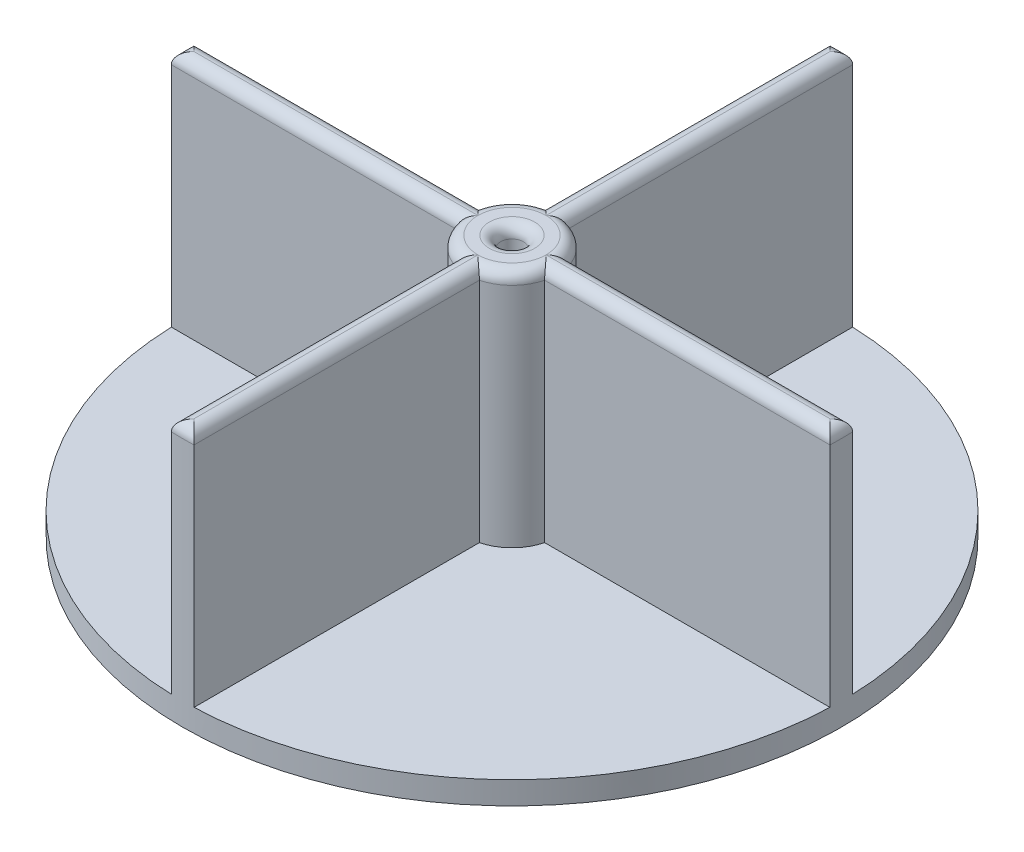
from build123d import *

# Parameters (mm, degrees)
SKETCH1_R           = 23.2
BOSS_EXTRUDE1_DEPTH = 1.6
BOSS_EXTRUDE2_DEPTH = 16.8
SKETCH3_R           = 0.7999999999999999
CUT_EXTRUDE1_DEPTH  = 38.617017425628
FILLET2_R           = 0.8


with BuildPart() as part:
    # Sketch1 → Boss-Extrude1 (new body)
    with BuildSketch(Plane(origin=(0, 0, 0), x_dir=(1, 0, 0), z_dir=(0, 1, 0))):
        with Locations(Location((0, 0, 0), (0, 0, 270))):
            Circle(SKETCH1_R)
    extrude(amount=BOSS_EXTRUDE1_DEPTH)

    # Sketch2 → Boss-Extrude2 (add)
    with BuildSketch(Plane(origin=(0, 1.6, 0), x_dir=(1, 0, 0), z_dir=(0, 1, 0))):
        with BuildLine():
            ThreePointArc((-0.7999999999999885, 3.098386676965936), (-2.2627416997969467, 2.2627416997969556), (-3.0983866769659336, 0.8000000000000005))
            Line((-3.098386676965933, 0.8000000000000005), (-23.1862027939031, 0.7999999999999974))
            ThreePointArc((-23.1862027939031, 0.7999999999999975), (-23.2, -3e-17), (-23.1862027939031, -0.7999999999999976))
            Line((-23.1862027939031, -0.7999999999999974), (-3.098386676965933, -0.7999999999999997))
            ThreePointArc((-3.0983866769659327, -0.7999999999999998), (-2.262741699796952, -2.262741699796952), (-0.7999999999999998, -3.0983866769659336))
            Line((-0.7999999999999999, -3.0983866769659336), (-0.8000000000002397, -23.186202793903092))
            ThreePointArc((-0.8000000000002399, -23.186202793903092), (-2.4261e-13, -23.200000000000003), (0.799999999999755, -23.186202793903107))
            Line((0.7999999999997549, -23.186202793903107), (0.7999999999999677, -3.0983866769659416))
            ThreePointArc((0.7999999999999678, -3.098386676965942), (2.2627416997969316, -2.2627416997969716), (3.0983866769659274, -0.8000000000000215))
            Line((3.098386676965927, -0.8000000000000214), (23.186202793903092, -0.8000000000001593))
            ThreePointArc((23.186202793903096, -0.8000000000001596), (23.199999999999996, -1.6184e-13), (23.18620279390311, 0.799999999999836))
            Line((23.186202793903107, 0.7999999999998355), (3.098386676965938, 0.7999999999999781))
            ThreePointArc((3.098386676965938, 0.7999999999999781), (2.262741699796959, 2.262741699796943), (0.8000000000000003, 3.0983866769659336))
            Line((0.8000000000000003, 3.098386676965933), (0.8000000000000788, 23.186202793903096))
            ThreePointArc((0.8000000000000786, 23.186202793903096), (8.138e-14, 23.199999999999992), (-0.799999999999916, 23.1862027939031))
            Line((-0.7999999999999159, 23.186202793903107), (-0.7999999999999884, 3.0983866769659354))
        make_face()
    extrude(amount=BOSS_EXTRUDE2_DEPTH)

    # Sketch3 → Cut-Extrude1 (cut, through all)
    with BuildSketch(Plane(origin=(0, 0, 0), x_dir=(-1, 0, 0), z_dir=(0, -1, 0))):
        with Locations(Location((0, 0, 0), (0, 0, 90))):
            Circle(SKETCH3_R)
    extrude(amount=-CUT_EXTRUDE1_DEPTH, mode=Mode.SUBTRACT)

    # Fillet2
    # the kernel refuses this fillet: 0.8 mm, written as the material it takes off along each edge
    with BuildSketch(Plane(origin=(-25.1862027939031, 18.400000000000002, 0.7999999999999972), x_dir=(1.2e-16, 0, -1), z_dir=(1, 0, 1.2e-16))) as fillet2_piece_1_section:
        with BuildLine():
            CenterArc((FILLET2_R, -FILLET2_R), FILLET2_R, 90, 90)
            Line((-1.1e-16, -FILLET2_R), (0, 0))
            Line((0, 0), (FILLET2_R, 0))
        make_face()
    fillet2_piece_1 = extrude(amount=24.08781611693717, mode=Mode.PRIVATE)
    fillet2_piece_1 = fillet2_piece_1 - Plane(origin=(-1.67e-15, 18.21874056473575, 2.89e-15), x_dir=(-0.9682458365518545, 0, 0.2499999999999993), z_dir=(0, -1, 0)) * Cylinder(3.199999999999997, 52, mode=Mode.PRIVATE)
    add(fillet2_piece_1, mode=Mode.SUBTRACT)
    with BuildSketch(Plane(origin=(0.7999999999997337, 18.400000000000002, 25.186202793903107), x_dir=(-1, 0, -1.059e-14), z_dir=(1.059e-14, 0, -1))) as fillet2_piece_2_section:
        with BuildLine():
            CenterArc((FILLET2_R, -FILLET2_R), FILLET2_R, 90, 90)
            Line((-1.1e-16, -FILLET2_R), (0, 0))
            Line((0, 0), (FILLET2_R, 0))
        make_face()
    fillet2_piece_2 = extrude(amount=24.08781611693717, mode=Mode.PRIVATE)
    fillet2_piece_2 = fillet2_piece_2 - Plane(origin=(-3.11e-15, 18.218740564735754, -2.22e-15), x_dir=(0.2499999999999907, 0, 0.9682458365518567), z_dir=(0, -1, 0)) * Cylinder(3.2000000000000033, 52, mode=Mode.PRIVATE)
    add(fillet2_piece_2, mode=Mode.SUBTRACT)
    with BuildSketch(Plane(origin=(25.186202793903107, 18.400000000000002, -0.7999999999998213), x_dir=(-7.1e-15, 0, 1), z_dir=(-1, 0, -7.1e-15))) as fillet2_piece_3_section:
        with BuildLine():
            CenterArc((FILLET2_R, -FILLET2_R), FILLET2_R, 90, 90)
            Line((-1.1e-16, -FILLET2_R), (0, 0))
            Line((0, 0), (FILLET2_R, 0))
        make_face()
    fillet2_piece_3 = extrude(amount=24.087816116937173, mode=Mode.PRIVATE)
    fillet2_piece_3 = fillet2_piece_3 - Plane(origin=(-4.66e-15, 18.21874056473575, 2.89e-15), x_dir=(0.9682458365518558, 0, -0.24999999999999373), z_dir=(0, -1, 0)) * Cylinder(3.200000000000004, 52, mode=Mode.PRIVATE)
    add(fillet2_piece_3, mode=Mode.SUBTRACT)
    with BuildSketch(Plane(origin=(-0.7999999999999087, 18.400000000000002, -25.186202793903107), x_dir=(1, 0, 3.61e-15), z_dir=(-3.61e-15, 0, 1))) as fillet2_piece_4_section:
        with BuildLine():
            CenterArc((FILLET2_R, -FILLET2_R), FILLET2_R, 90, 90)
            Line((-1.1e-16, -FILLET2_R), (0, 0))
            Line((0, 0), (FILLET2_R, 0))
        make_face()
    fillet2_piece_4 = extrude(amount=24.087816116937173, mode=Mode.PRIVATE)
    fillet2_piece_4 = fillet2_piece_4 - Plane(origin=(7.77e-15, 18.21874056473575, 8.88e-15), x_dir=(-0.24999999999999808, 0, -0.9682458365518548), z_dir=(0, -1, 0)) * Cylinder(3.20000000000001, 52, mode=Mode.PRIVATE)
    add(fillet2_piece_4, mode=Mode.SUBTRACT)
    with BuildSketch(Plane(origin=(1.81188e-12, 18.400000000000002, 3e-17), x_dir=(-0.9927250083594872, 0, -0.12040372825480125), z_dir=(0.12040372825480125, 0, -0.9927250083594872))) as fillet2_piece_5:
        with BuildLine():
            CenterArc((23.2000000000018 - FILLET2_R, -FILLET2_R), FILLET2_R, 0, 90)
            Line((23.200000000001797, -FILLET2_R), (23.2000000000018, 0))
            Line((23.2000000000018, 0), (23.2000000000018 - FILLET2_R, 0))
        make_face()
    revolve(axis=Axis((1.81188e-12, 18.400000000000002, 3e-17), (0, 1, 0)), revolution_arc=13.83080689642434, mode=Mode.SUBTRACT)
    with BuildSketch(Plane(origin=(-1.67e-15, 18.400000000000002, 2.89e-15), x_dir=(-0.9314439639162286, 0, -0.36388479232309684), z_dir=(0.36388479232309684, 0, -0.9314439639162286))) as fillet2_piece_6_section:
        with BuildLine():
            CenterArc((3.200000000000247 - FILLET2_R, -FILLET2_R), FILLET2_R, 0, 90)
            Line((3.200000000000247, -FILLET2_R), (3.200000000000247, 0))
            Line((3.200000000000247, 0), (3.200000000000247 - FILLET2_R, 0))
        make_face()
    fillet2_piece_6 = revolve(axis=Axis((-1.67e-15, 18.400000000000002, 2.89e-15), (0, 1, 0)), revolution_arc=132.67793405188988, mode=Mode.PRIVATE)
    fillet2_piece_6 = split(fillet2_piece_6, bisect_by=Plane(origin=(-2.899483570840335, 18.197678249035157, -0.8000000000000005), z_dir=(-1.5e-16, 0, -1)), keep=Keep.TOP, mode=Mode.PRIVATE)
    add(fillet2_piece_6, mode=Mode.SUBTRACT)
    with BuildSketch(Plane(origin=(-1.67e-15, 18.400000000000002, 2.89e-15), x_dir=(-0.9314439639162286, 0, -0.36388479232309684), z_dir=(0.36388479232309684, 0, -0.9314439639162286))) as fillet2_piece_7_section:
        with BuildLine():
            CenterArc((3.200000000000247 - FILLET2_R, -FILLET2_R), FILLET2_R, 0, 90)
            Line((3.200000000000247, -FILLET2_R), (3.200000000000247, 0))
            Line((3.200000000000247, 0), (3.200000000000247 - FILLET2_R, 0))
        make_face()
    fillet2_piece_7 = revolve(axis=Axis((-1.67e-15, 18.400000000000002, 2.89e-15), (0, 1, 0)), revolution_arc=132.67793405188988, mode=Mode.PRIVATE)
    fillet2_piece_7 = split(fillet2_piece_7, bisect_by=Plane(origin=(-0.799999999999988, 18.171333398613715, 2.101049995326022), z_dir=(-1, 0, -1.194e-14)), keep=Keep.TOP, mode=Mode.PRIVATE)
    fillet2_piece_7 = split(fillet2_piece_7, bisect_by=Plane(origin=(-2.101049995326008, 18.171333398613715, 0.7999999999999998), z_dir=(-1.2e-16, 0, 1)), keep=Keep.TOP, mode=Mode.PRIVATE)
    add(fillet2_piece_7, mode=Mode.SUBTRACT)
    with BuildSketch(Plane(origin=(-1.67e-15, 18.400000000000002, 2.89e-15), x_dir=(-0.9314439639162286, 0, -0.36388479232309684), z_dir=(0.36388479232309684, 0, -0.9314439639162286))) as fillet2_piece_8_section:
        with BuildLine():
            CenterArc((3.200000000000247 - FILLET2_R, -FILLET2_R), FILLET2_R, 0, 90)
            Line((3.200000000000247, -FILLET2_R), (3.200000000000247, 0))
            Line((3.200000000000247, 0), (3.200000000000247 - FILLET2_R, 0))
        make_face()
    fillet2_piece_8 = revolve(axis=Axis((-1.67e-15, 18.400000000000002, 2.89e-15), (0, 1, 0)), revolution_arc=132.67793405188988, mode=Mode.PRIVATE)
    fillet2_piece_8 = split(fillet2_piece_8, bisect_by=Plane(origin=(0.7999999999999698, 18.197678297471455, 2.899483575164183), z_dir=(1, 0, 1.059e-14)), keep=Keep.TOP, mode=Mode.PRIVATE)
    add(fillet2_piece_8, mode=Mode.SUBTRACT)
    with BuildSketch(Plane(origin=(-0.7999999999999761, 18.400000000000002, 1.0983866769659318), x_dir=(0, -1, 0), z_dir=(-1.194e-14, 0, 1))) as fillet2_piece_9_section:
        with BuildLine():
            CenterArc((FILLET2_R, FILLET2_R), FILLET2_R, 180, 90)
            Line((0, FILLET2_R), (0, 0))
            Line((0, 0), (FILLET2_R, 0))
        make_face()
    fillet2_piece_9 = extrude(amount=24.087816116937162, mode=Mode.PRIVATE)
    fillet2_piece_9 = fillet2_piece_9 - Plane(origin=(-1.67e-15, 18.218740589292803, 2.89e-15), x_dir=(-0.9682458365518545, 0, 0.2499999999999993), z_dir=(0, -1, 0)) * Cylinder(3.199999999999997, 52, mode=Mode.PRIVATE)
    add(fillet2_piece_9, mode=Mode.SUBTRACT)
    with BuildSketch(Plane(origin=(-3.653e-14, 18.400000000000002, 5.22427e-12), x_dir=(-0.12040372825484637, 0, 0.9927250083594816), z_dir=(-0.9927250083594816, 0, -0.12040372825484637))) as fillet2_piece_10:
        with BuildLine():
            CenterArc((23.199999999994805 - FILLET2_R, -FILLET2_R), FILLET2_R, 0, 90)
            Line((23.199999999994805 - FILLET2_R, 0), (23.199999999994805, 0))
            Line((23.199999999994805, 0), (23.199999999994805, -FILLET2_R))
        make_face()
    revolve(axis=Axis((-3.653e-14, 18.400000000000002, 5.22427e-12), (0, 1, 0)), revolution_arc=13.830806896428529, mode=Mode.SUBTRACT)
    with BuildSketch(Plane(origin=(-3.11e-15, 18.400000000000002, -2.22e-15), x_dir=(-0.3638847923231041, 0, 0.9314439639162259), z_dir=(-0.9314439639162259, 0, -0.3638847923231041))) as fillet2_piece_11_section:
        with BuildLine():
            CenterArc((3.2000000000002538 - FILLET2_R, -FILLET2_R), FILLET2_R, 0, 90)
            Line((3.2000000000002538, -FILLET2_R), (3.2000000000002538, 0))
            Line((3.2000000000002538, 0), (3.2000000000002538 - FILLET2_R, 0))
        make_face()
    fillet2_piece_11 = revolve(axis=Axis((-3.11e-15, 18.400000000000002, -2.22e-15), (0, 1, 0)), revolution_arc=132.6779340518898, mode=Mode.PRIVATE)
    fillet2_piece_11 = split(fillet2_piece_11, bisect_by=Plane(origin=(-0.7999999999999976, 18.19767824903516, 2.8994835708403333), z_dir=(-1, 0, -1.194e-14)), keep=Keep.TOP, mode=Mode.PRIVATE)
    add(fillet2_piece_11, mode=Mode.SUBTRACT)
    with BuildSketch(Plane(origin=(-3.11e-15, 18.400000000000002, -2.22e-15), x_dir=(-0.3638847923231041, 0, 0.9314439639162259), z_dir=(-0.9314439639162259, 0, -0.3638847923231041))) as fillet2_piece_12_section:
        with BuildLine():
            CenterArc((3.2000000000002538 - FILLET2_R, -FILLET2_R), FILLET2_R, 0, 90)
            Line((3.2000000000002538, -FILLET2_R), (3.2000000000002538, 0))
            Line((3.2000000000002538, 0), (3.2000000000002538 - FILLET2_R, 0))
        make_face()
    fillet2_piece_12 = revolve(axis=Axis((-3.11e-15, 18.400000000000002, -2.22e-15), (0, 1, 0)), revolution_arc=132.6779340518898, mode=Mode.PRIVATE)
    fillet2_piece_12 = split(fillet2_piece_12, bisect_by=Plane(origin=(0.7999999999999783, 18.171333398613715, 2.1010499953260116), z_dir=(1, 0, 1.059e-14)), keep=Keep.TOP, mode=Mode.PRIVATE)
    fillet2_piece_12 = split(fillet2_piece_12, bisect_by=Plane(origin=(2.1010499953259982, 18.171333398613715, 0.8000000000000145), z_dir=(-6.86e-15, 0, 1)), keep=Keep.TOP, mode=Mode.PRIVATE)
    add(fillet2_piece_12, mode=Mode.SUBTRACT)
    with BuildSketch(Plane(origin=(-3.11e-15, 18.400000000000002, -2.22e-15), x_dir=(-0.3638847923231041, 0, 0.9314439639162259), z_dir=(-0.9314439639162259, 0, -0.3638847923231041))) as fillet2_piece_13_section:
        with BuildLine():
            CenterArc((3.2000000000002538 - FILLET2_R, -FILLET2_R), FILLET2_R, 0, 90)
            Line((3.2000000000002538, -FILLET2_R), (3.2000000000002538, 0))
            Line((3.2000000000002538, 0), (3.2000000000002538 - FILLET2_R, 0))
        make_face()
    fillet2_piece_13 = revolve(axis=Axis((-3.11e-15, 18.400000000000002, -2.22e-15), (0, 1, 0)), revolution_arc=132.6779340518898, mode=Mode.PRIVATE)
    fillet2_piece_13 = split(fillet2_piece_13, bisect_by=Plane(origin=(2.8994835751641936, 18.197678297471455, -0.7999999999999795), z_dir=(7.1e-15, 0, -1)), keep=Keep.TOP, mode=Mode.PRIVATE)
    add(fillet2_piece_13, mode=Mode.SUBTRACT)
    with BuildSketch(Plane(origin=(1.0983866769659252, 18.400000000000002, 0.8000000000000076), x_dir=(6.86e-15, 0, -1), z_dir=(1, 0, 6.86e-15))) as fillet2_piece_14_section:
        with BuildLine():
            CenterArc((FILLET2_R, -FILLET2_R), FILLET2_R, 90, 90)
            Line((-1.1e-16, -FILLET2_R), (0, 0))
            Line((0, 0), (FILLET2_R, 0))
        make_face()
    fillet2_piece_14 = extrude(amount=24.08781611693717, mode=Mode.PRIVATE)
    fillet2_piece_14 = fillet2_piece_14 - Plane(origin=(-3.11e-15, 18.21874057940672, -2.22e-15), x_dir=(0.2499999999999907, 0, 0.9682458365518567), z_dir=(0, -1, 0)) * Cylinder(3.2000000000000033, 52, mode=Mode.PRIVATE)
    add(fillet2_piece_14, mode=Mode.SUBTRACT)
    with BuildSketch(Plane(origin=(-7.19247e-12, 18.400000000000002, -4.416e-14), x_dir=(0.9927250083594895, 0, 0.12040372825478234), z_dir=(-0.12040372825478234, 0, 0.9927250083594895))) as fillet2_piece_15:
        with BuildLine():
            CenterArc((23.200000000007144 - FILLET2_R, -FILLET2_R), FILLET2_R, 0, 90)
            Line((23.200000000007144 - FILLET2_R, 0), (23.200000000007144, 0))
            Line((23.200000000007144, 0), (23.200000000007144, -FILLET2_R))
        make_face()
    revolve(axis=Axis((-7.19247e-12, 18.400000000000002, -4.416e-14), (0, 1, 0)), revolution_arc=13.830806896421134, mode=Mode.SUBTRACT)
    with BuildSketch(Plane(origin=(-4.66e-15, 18.400000000000002, 2.89e-15), x_dir=(0.931443963916227, 0, 0.36388479232310106), z_dir=(-0.36388479232310106, 0, 0.931443963916227))) as fillet2_piece_16_section:
        with BuildLine():
            CenterArc((3.2000000000002524 - FILLET2_R, -FILLET2_R), FILLET2_R, 0, 90)
            Line((3.200000000000252, -FILLET2_R), (3.2000000000002524, 0))
            Line((3.2000000000002524, 0), (3.2000000000002524 - FILLET2_R, 0))
        make_face()
    fillet2_piece_16 = revolve(axis=Axis((-4.66e-15, 18.400000000000002, 2.89e-15), (0, 1, 0)), revolution_arc=132.67793405189, mode=Mode.PRIVATE)
    fillet2_piece_16 = split(fillet2_piece_16, bisect_by=Plane(origin=(2.8994835708403315, 18.197678249035157, 0.80000000000002), z_dir=(-6.86e-15, 0, 1)), keep=Keep.TOP, mode=Mode.PRIVATE)
    add(fillet2_piece_16, mode=Mode.SUBTRACT)
    with BuildSketch(Plane(origin=(-4.66e-15, 18.400000000000002, 2.89e-15), x_dir=(0.931443963916227, 0, 0.36388479232310106), z_dir=(-0.36388479232310106, 0, 0.931443963916227))) as fillet2_piece_17_section:
        with BuildLine():
            CenterArc((3.2000000000002524 - FILLET2_R, -FILLET2_R), FILLET2_R, 0, 90)
            Line((3.200000000000252, -FILLET2_R), (3.2000000000002524, 0))
            Line((3.2000000000002524, 0), (3.2000000000002524 - FILLET2_R, 0))
        make_face()
    fillet2_piece_17 = revolve(axis=Axis((-4.66e-15, 18.400000000000002, 2.89e-15), (0, 1, 0)), revolution_arc=132.67793405189, mode=Mode.PRIVATE)
    fillet2_piece_17 = split(fillet2_piece_17, bisect_by=Plane(origin=(2.1010499953260044, 18.171333398613715, -0.7999999999999852), z_dir=(7.1e-15, 0, -1)), keep=Keep.TOP, mode=Mode.PRIVATE)
    fillet2_piece_17 = split(fillet2_piece_17, bisect_by=Plane(origin=(0.7999999999999964, 18.171333398613715, -2.1010499953260013), z_dir=(1, 0, 3.91e-15)), keep=Keep.TOP, mode=Mode.PRIVATE)
    add(fillet2_piece_17, mode=Mode.SUBTRACT)
    with BuildSketch(Plane(origin=(-4.66e-15, 18.400000000000002, 2.89e-15), x_dir=(0.931443963916227, 0, 0.36388479232310106), z_dir=(-0.36388479232310106, 0, 0.931443963916227))) as fillet2_piece_18_section:
        with BuildLine():
            CenterArc((3.2000000000002524 - FILLET2_R, -FILLET2_R), FILLET2_R, 0, 90)
            Line((3.200000000000252, -FILLET2_R), (3.2000000000002524, 0))
            Line((3.2000000000002524, 0), (3.2000000000002524 - FILLET2_R, 0))
        make_face()
    fillet2_piece_18 = revolve(axis=Axis((-4.66e-15, 18.400000000000002, 2.89e-15), (0, 1, 0)), revolution_arc=132.67793405189, mode=Mode.PRIVATE)
    fillet2_piece_18 = split(fillet2_piece_18, bisect_by=Plane(origin=(-0.799999999999989, 18.19767829747145, -2.8994835751641865), z_dir=(-1, 0, -3.61e-15)), keep=Keep.TOP, mode=Mode.PRIVATE)
    add(fillet2_piece_18, mode=Mode.SUBTRACT)
    with BuildSketch(Plane(origin=(0.7999999999999925, 18.400000000000002, -1.0983866769659314), x_dir=(-1, 0, -3.91e-15), z_dir=(3.91e-15, 0, -1))) as fillet2_piece_19_section:
        with BuildLine():
            CenterArc((FILLET2_R, -FILLET2_R), FILLET2_R, 90, 90)
            Line((-1.1e-16, -FILLET2_R), (0, 0))
            Line((0, 0), (FILLET2_R, 0))
        make_face()
    fillet2_piece_19 = extrude(amount=24.08781611693717, mode=Mode.PRIVATE)
    fillet2_piece_19 = fillet2_piece_19 - Plane(origin=(-4.66e-15, 18.21874057940672, 2.89e-15), x_dir=(0.9682458365518558, 0, -0.24999999999999373), z_dir=(0, -1, 0)) * Cylinder(3.200000000000004, 52, mode=Mode.PRIVATE)
    add(fillet2_piece_19, mode=Mode.SUBTRACT)
    with BuildSketch(Plane(origin=(2.984e-14, 18.400000000000002, 5.85487e-12), x_dir=(0.12040372825478259, 0, -0.9927250083594896), z_dir=(0.9927250083594896, 0, 0.12040372825478259))) as fillet2_piece_20:
        with BuildLine():
            CenterArc((23.20000000000581 - FILLET2_R, -FILLET2_R), FILLET2_R, 0, 90)
            Line((23.20000000000581 - FILLET2_R, 0), (23.20000000000581, 0))
            Line((23.20000000000581, 0), (23.20000000000581, -FILLET2_R))
        make_face()
    revolve(axis=Axis((2.984e-14, 18.400000000000002, 5.85487e-12), (0, 1, 0)), revolution_arc=13.83080689642193, mode=Mode.SUBTRACT)
    with BuildSketch(Plane(origin=(7.77e-15, 18.400000000000002, 8.88e-15), x_dir=(0.36388479232309584, 0, -0.9314439639162291), z_dir=(0.9314439639162291, 0, 0.36388479232309584))) as fillet2_piece_21_section:
        with BuildLine():
            CenterArc((3.200000000000259 - FILLET2_R, -FILLET2_R), FILLET2_R, 0, 90)
            Line((3.200000000000259, -FILLET2_R), (3.200000000000259, 0))
            Line((3.200000000000259, 0), (3.200000000000259 - FILLET2_R, 0))
        make_face()
    fillet2_piece_21 = revolve(axis=Axis((7.77e-15, 18.400000000000002, 8.88e-15), (0, 1, 0)), revolution_arc=132.6779340518895, mode=Mode.PRIVATE)
    fillet2_piece_21 = split(fillet2_piece_21, bisect_by=Plane(origin=(0.7999999999999995, 18.197678249035153, -2.899483570840339), z_dir=(1, 0, 3.91e-15)), keep=Keep.TOP, mode=Mode.PRIVATE)
    add(fillet2_piece_21, mode=Mode.SUBTRACT)
    with BuildSketch(Plane(origin=(7.77e-15, 18.400000000000002, 8.88e-15), x_dir=(0.36388479232309584, 0, -0.9314439639162291), z_dir=(0.9314439639162291, 0, 0.36388479232309584))) as fillet2_piece_22_section:
        with BuildLine():
            CenterArc((3.200000000000259 - FILLET2_R, -FILLET2_R), FILLET2_R, 0, 90)
            Line((3.200000000000259, -FILLET2_R), (3.200000000000259, 0))
            Line((3.200000000000259, 0), (3.200000000000259 - FILLET2_R, 0))
        make_face()
    fillet2_piece_22 = revolve(axis=Axis((7.77e-15, 18.400000000000002, 8.88e-15), (0, 1, 0)), revolution_arc=132.6779340518895, mode=Mode.PRIVATE)
    fillet2_piece_22 = split(fillet2_piece_22, bisect_by=Plane(origin=(-0.7999999999999919, 18.171333398613715, -2.1010499953260044), z_dir=(-1, 0, -3.61e-15)), keep=Keep.TOP, mode=Mode.PRIVATE)
    fillet2_piece_22 = split(fillet2_piece_22, bisect_by=Plane(origin=(-2.1010499953260005, 18.171333398613715, -0.8000000000000006), z_dir=(-1.5e-16, 0, -1)), keep=Keep.TOP, mode=Mode.PRIVATE)
    add(fillet2_piece_22, mode=Mode.SUBTRACT)
    with BuildSketch(Plane(origin=(7.77e-15, 18.400000000000002, 8.88e-15), x_dir=(0.36388479232309584, 0, -0.9314439639162291), z_dir=(0.9314439639162291, 0, 0.36388479232309584))) as fillet2_piece_23_section:
        with BuildLine():
            CenterArc((3.200000000000259 - FILLET2_R, -FILLET2_R), FILLET2_R, 0, 90)
            Line((3.200000000000259, -FILLET2_R), (3.200000000000259, 0))
            Line((3.200000000000259, 0), (3.200000000000259 - FILLET2_R, 0))
        make_face()
    fillet2_piece_23 = revolve(axis=Axis((7.77e-15, 18.400000000000002, 8.88e-15), (0, 1, 0)), revolution_arc=132.6779340518895, mode=Mode.PRIVATE)
    fillet2_piece_23 = split(fillet2_piece_23, bisect_by=Plane(origin=(-2.8994835751641936, 18.19767829747145, 0.7999999999999997), z_dir=(-1.2e-16, 0, 1)), keep=Keep.TOP, mode=Mode.PRIVATE)
    add(fillet2_piece_23, mode=Mode.SUBTRACT)
    with BuildSketch(Plane(origin=(-1.0983866769659314, 18.400000000000002, -0.8000000000000008), x_dir=(1.5e-16, 0, 1), z_dir=(-1, 0, 1.5e-16))) as fillet2_piece_24_section:
        with BuildLine():
            CenterArc((FILLET2_R, -FILLET2_R), FILLET2_R, 90, 90)
            Line((-1.1e-16, -FILLET2_R), (0, 0))
            Line((0, 0), (FILLET2_R, 0))
        make_face()
    fillet2_piece_24 = extrude(amount=24.087816116937173, mode=Mode.PRIVATE)
    fillet2_piece_24 = fillet2_piece_24 - Plane(origin=(7.77e-15, 18.218740579406724, 8.88e-15), x_dir=(-0.24999999999999808, 0, -0.9682458365518548), z_dir=(0, -1, 0)) * Cylinder(3.20000000000001, 52, mode=Mode.PRIVATE)
    add(fillet2_piece_24, mode=Mode.SUBTRACT)
    with BuildSketch(Plane(origin=(0, 18.400000000000002, 0), x_dir=(-6e-17, 0, -1), z_dir=(-1, 0, 6e-17))) as fillet2_piece_25:
        with BuildLine():
            CenterArc((0.7999999999999999 + FILLET2_R, FILLET2_R), FILLET2_R, 180, 90)
            Line((0.7999999999999998, FILLET2_R), (0.7999999999999999, 0))
            Line((0.7999999999999999, 0), (0.7999999999999999 + FILLET2_R, 0))
        make_face()
    revolve(axis=Axis((0, 18.400000000000002, 0), (0, -1, 0)), mode=Mode.SUBTRACT)
    with BuildSketch(Plane(origin=(-1.67e-15, 18.400000000000002, 2.89e-15), x_dir=(-0.9314439639162286, 0, -0.36388479232309684), z_dir=(0.36388479232309684, 0, -0.9314439639162286))) as fillet2_piece_26a_section:
        with BuildLine():
            CenterArc((3.200000000000247 - FILLET2_R, -FILLET2_R), FILLET2_R, 0, 90)
            Line((3.200000000000247, -FILLET2_R), (3.200000000000247, 0))
            Line((3.200000000000247, 0), (3.200000000000247 - FILLET2_R, 0))
        make_face()
    fillet2_piece_26a = revolve(axis=Axis((-1.67e-15, 18.400000000000002, 2.89e-15), (0, 1, 0)), revolution_arc=132.67793405188988, mode=Mode.PRIVATE)
    fillet2_piece_26a = split(fillet2_piece_26a, bisect_by=Plane(origin=(-2.9823993189922824, 18.21903926693095, 0.7999999999999997), z_dir=(1.2e-16, 0, -1)), keep=Keep.TOP, mode=Mode.PRIVATE)
    fillet2_piece_26a = split(fillet2_piece_26a, bisect_by=Plane(origin=(-2.982399318992282, 18.21903926693095, -0.8000000000000005), z_dir=(1.5e-16, 0, 1)), keep=Keep.TOP, mode=Mode.PRIVATE)
    with BuildSketch(Plane(origin=(-25.1862027939031, 18.400000000000002, 0.7999999999999972), x_dir=(1.2e-16, 0, -1), z_dir=(1, 0, 1.2e-16))) as fillet2_piece_26b_section:
        with BuildLine():
            CenterArc((FILLET2_R, -FILLET2_R), FILLET2_R, 90, 90)
            Line((-1.1e-16, -FILLET2_R), (0, 0))
            Line((0, 0), (FILLET2_R, 0))
        make_face()
    fillet2_piece_26b = extrude(amount=24.08781611693717, mode=Mode.PRIVATE)
    fillet2_piece_26b = fillet2_piece_26b & Plane(origin=(-1.67e-15, 18.220436085358216, 2.89e-15), x_dir=(-0.9682458365518545, 0, 0.2499999999999993), z_dir=(0, -1, 0)) * Cylinder(3.199999999999997, 52, mode=Mode.PRIVATE)
    fillet2_piece_26 = fillet2_piece_26a & fillet2_piece_26b
    add(fillet2_piece_26, mode=Mode.SUBTRACT)
    with BuildSketch(Plane(origin=(-3.11e-15, 18.400000000000002, -2.22e-15), x_dir=(-0.3638847923231041, 0, 0.9314439639162259), z_dir=(-0.9314439639162259, 0, -0.3638847923231041))) as fillet2_piece_27a_section:
        with BuildLine():
            CenterArc((3.2000000000002538 - FILLET2_R, -FILLET2_R), FILLET2_R, 0, 90)
            Line((3.2000000000002538, -FILLET2_R), (3.2000000000002538, 0))
            Line((3.2000000000002538, 0), (3.2000000000002538 - FILLET2_R, 0))
        make_face()
    fillet2_piece_27a = revolve(axis=Axis((-3.11e-15, 18.400000000000002, -2.22e-15), (0, 1, 0)), revolution_arc=132.6779340518898, mode=Mode.PRIVATE)
    fillet2_piece_27a = split(fillet2_piece_27a, bisect_by=Plane(origin=(-0.7999999999999986, 18.219039266930952, 2.982399318992277), z_dir=(1, 0, 1.194e-14)), keep=Keep.TOP, mode=Mode.PRIVATE)
    fillet2_piece_27a = split(fillet2_piece_27a, bisect_by=Plane(origin=(0.799999999999969, 18.219039266930952, 2.982399318992293), z_dir=(-1, 0, -1.059e-14)), keep=Keep.TOP, mode=Mode.PRIVATE)
    with BuildSketch(Plane(origin=(0.7999999999997337, 18.400000000000002, 25.186202793903107), x_dir=(-1, 0, -1.059e-14), z_dir=(1.059e-14, 0, -1))) as fillet2_piece_27b_section:
        with BuildLine():
            CenterArc((FILLET2_R, -FILLET2_R), FILLET2_R, 90, 90)
            Line((-1.1e-16, -FILLET2_R), (0, 0))
            Line((0, 0), (FILLET2_R, 0))
        make_face()
    fillet2_piece_27b = extrude(amount=24.08781611693717, mode=Mode.PRIVATE)
    fillet2_piece_27b = fillet2_piece_27b & Plane(origin=(-3.11e-15, 18.220436085358216, -2.22e-15), x_dir=(0.2499999999999907, 0, 0.9682458365518567), z_dir=(0, -1, 0)) * Cylinder(3.2000000000000033, 52, mode=Mode.PRIVATE)
    fillet2_piece_27 = fillet2_piece_27a & fillet2_piece_27b
    add(fillet2_piece_27, mode=Mode.SUBTRACT)
    with BuildSketch(Plane(origin=(25.186202793903107, 18.400000000000002, -0.7999999999998213), x_dir=(-7.1e-15, 0, 1), z_dir=(-1, 0, -7.1e-15))) as fillet2_piece_28a_section:
        with BuildLine():
            CenterArc((FILLET2_R, -FILLET2_R), FILLET2_R, 90, 90)
            Line((-1.1e-16, -FILLET2_R), (0, 0))
            Line((0, 0), (FILLET2_R, 0))
        make_face()
    fillet2_piece_28a = extrude(amount=24.087816116937173, mode=Mode.PRIVATE)
    fillet2_piece_28a = fillet2_piece_28a & Plane(origin=(-4.66e-15, 18.220436085358216, 2.89e-15), x_dir=(0.9682458365518558, 0, -0.24999999999999373), z_dir=(0, -1, 0)) * Cylinder(3.200000000000004, 52, mode=Mode.PRIVATE)
    with BuildSketch(Plane(origin=(-4.66e-15, 18.400000000000002, 2.89e-15), x_dir=(0.931443963916227, 0, 0.36388479232310106), z_dir=(-0.36388479232310106, 0, 0.931443963916227))) as fillet2_piece_28b_section:
        with BuildLine():
            CenterArc((3.2000000000002524 - FILLET2_R, -FILLET2_R), FILLET2_R, 0, 90)
            Line((3.200000000000252, -FILLET2_R), (3.2000000000002524, 0))
            Line((3.2000000000002524, 0), (3.2000000000002524 - FILLET2_R, 0))
        make_face()
    fillet2_piece_28b = revolve(axis=Axis((-4.66e-15, 18.400000000000002, 2.89e-15), (0, 1, 0)), revolution_arc=132.67793405189, mode=Mode.PRIVATE)
    fillet2_piece_28b = split(fillet2_piece_28b, bisect_by=Plane(origin=(2.9823993189922775, 18.219039266930952, 0.8000000000000206), z_dir=(6.86e-15, 0, -1)), keep=Keep.TOP, mode=Mode.PRIVATE)
    fillet2_piece_28b = split(fillet2_piece_28b, bisect_by=Plane(origin=(2.9823993189922895, 18.219039266930952, -0.7999999999999788), z_dir=(-7.1e-15, 0, 1)), keep=Keep.TOP, mode=Mode.PRIVATE)
    fillet2_piece_28 = fillet2_piece_28a & fillet2_piece_28b
    add(fillet2_piece_28, mode=Mode.SUBTRACT)
    with BuildSketch(Plane(origin=(-0.7999999999999087, 18.400000000000002, -25.186202793903107), x_dir=(1, 0, 3.61e-15), z_dir=(-3.61e-15, 0, 1))) as fillet2_piece_29a_section:
        with BuildLine():
            CenterArc((FILLET2_R, -FILLET2_R), FILLET2_R, 90, 90)
            Line((-1.1e-16, -FILLET2_R), (0, 0))
            Line((0, 0), (FILLET2_R, 0))
        make_face()
    fillet2_piece_29a = extrude(amount=24.087816116937173, mode=Mode.PRIVATE)
    fillet2_piece_29a = fillet2_piece_29a & Plane(origin=(7.77e-15, 18.220436085358216, 8.88e-15), x_dir=(-0.24999999999999808, 0, -0.9682458365518548), z_dir=(0, -1, 0)) * Cylinder(3.20000000000001, 52, mode=Mode.PRIVATE)
    with BuildSketch(Plane(origin=(7.77e-15, 18.400000000000002, 8.88e-15), x_dir=(0.36388479232309584, 0, -0.9314439639162291), z_dir=(0.9314439639162291, 0, 0.36388479232309584))) as fillet2_piece_29b_section:
        with BuildLine():
            CenterArc((3.200000000000259 - FILLET2_R, -FILLET2_R), FILLET2_R, 0, 90)
            Line((3.200000000000259, -FILLET2_R), (3.200000000000259, 0))
            Line((3.200000000000259, 0), (3.200000000000259 - FILLET2_R, 0))
        make_face()
    fillet2_piece_29b = revolve(axis=Axis((7.77e-15, 18.400000000000002, 8.88e-15), (0, 1, 0)), revolution_arc=132.6779340518895, mode=Mode.PRIVATE)
    fillet2_piece_29b = split(fillet2_piece_29b, bisect_by=Plane(origin=(0.7999999999999998, 18.21903926693095, -2.9823993189922833), z_dir=(-1, 0, -3.91e-15)), keep=Keep.TOP, mode=Mode.PRIVATE)
    fillet2_piece_29b = split(fillet2_piece_29b, bisect_by=Plane(origin=(-0.7999999999999888, 18.21903926693095, -2.9823993189922895), z_dir=(1, 0, 3.61e-15)), keep=Keep.TOP, mode=Mode.PRIVATE)
    fillet2_piece_29 = fillet2_piece_29a & fillet2_piece_29b
    add(fillet2_piece_29, mode=Mode.SUBTRACT)
    with BuildSketch(Plane(origin=(-0.7999999999999761, 18.400000000000002, 1.0983866769659318), x_dir=(0, -1, 0), z_dir=(-1.194e-14, 0, 1))) as fillet2_piece_30a_section:
        with BuildLine():
            CenterArc((FILLET2_R, FILLET2_R), FILLET2_R, 180, 90)
            Line((0, FILLET2_R), (0, 0))
            Line((0, 0), (FILLET2_R, 0))
        make_face()
    fillet2_piece_30a = extrude(amount=24.087816116937162, mode=Mode.PRIVATE)
    fillet2_piece_30a = fillet2_piece_30a & Plane(origin=(-1.67e-15, 18.220436109659172, 2.89e-15), x_dir=(-0.9682458365518545, 0, 0.2499999999999993), z_dir=(0, -1, 0)) * Cylinder(3.199999999999997, 52, mode=Mode.PRIVATE)
    with BuildSketch(Plane(origin=(-1.67e-15, 18.400000000000002, 2.89e-15), x_dir=(-0.9314439639162286, 0, -0.36388479232309684), z_dir=(0.36388479232309684, 0, -0.9314439639162286))) as fillet2_piece_30b_section:
        with BuildLine():
            CenterArc((3.200000000000247 - FILLET2_R, -FILLET2_R), FILLET2_R, 0, 90)
            Line((3.200000000000247, -FILLET2_R), (3.200000000000247, 0))
            Line((3.200000000000247, 0), (3.200000000000247 - FILLET2_R, 0))
        make_face()
    fillet2_piece_30b = revolve(axis=Axis((-1.67e-15, 18.400000000000002, 2.89e-15), (0, 1, 0)), revolution_arc=132.67793405188988, mode=Mode.PRIVATE)
    fillet2_piece_30b = split(fillet2_piece_30b, bisect_by=Plane(origin=(-0.7999999999999986, 18.219039266930945, 2.9823993189922757), z_dir=(1, 0, 1.194e-14)), keep=Keep.TOP, mode=Mode.PRIVATE)
    fillet2_piece_30b = split(fillet2_piece_30b, bisect_by=Plane(origin=(0.799999999999969, 18.219039266930945, 2.982399318992293), z_dir=(-1, 0, -1.059e-14)), keep=Keep.TOP, mode=Mode.PRIVATE)
    fillet2_piece_30 = fillet2_piece_30a & fillet2_piece_30b
    add(fillet2_piece_30, mode=Mode.SUBTRACT)
    with BuildSketch(Plane(origin=(1.0983866769659252, 18.400000000000002, 0.8000000000000076), x_dir=(6.86e-15, 0, -1), z_dir=(1, 0, 6.86e-15))) as fillet2_piece_31a_section:
        with BuildLine():
            CenterArc((FILLET2_R, -FILLET2_R), FILLET2_R, 90, 90)
            Line((-1.1e-16, -FILLET2_R), (0, 0))
            Line((0, 0), (FILLET2_R, 0))
        make_face()
    fillet2_piece_31a = extrude(amount=24.08781611693717, mode=Mode.PRIVATE)
    fillet2_piece_31a = fillet2_piece_31a & Plane(origin=(-3.11e-15, 18.220436097418194, -2.22e-15), x_dir=(0.2499999999999907, 0, 0.9682458365518567), z_dir=(0, -1, 0)) * Cylinder(3.2000000000000033, 52, mode=Mode.PRIVATE)
    with BuildSketch(Plane(origin=(-3.11e-15, 18.400000000000002, -2.22e-15), x_dir=(-0.3638847923231041, 0, 0.9314439639162259), z_dir=(-0.9314439639162259, 0, -0.3638847923231041))) as fillet2_piece_31b_section:
        with BuildLine():
            CenterArc((3.2000000000002538 - FILLET2_R, -FILLET2_R), FILLET2_R, 0, 90)
            Line((3.2000000000002538, -FILLET2_R), (3.2000000000002538, 0))
            Line((3.2000000000002538, 0), (3.2000000000002538 - FILLET2_R, 0))
        make_face()
    fillet2_piece_31b = revolve(axis=Axis((-3.11e-15, 18.400000000000002, -2.22e-15), (0, 1, 0)), revolution_arc=132.6779340518898, mode=Mode.PRIVATE)
    fillet2_piece_31b = split(fillet2_piece_31b, bisect_by=Plane(origin=(2.9823993189922797, 18.219039266930952, 0.8000000000000206), z_dir=(6.86e-15, 0, -1)), keep=Keep.TOP, mode=Mode.PRIVATE)
    fillet2_piece_31b = split(fillet2_piece_31b, bisect_by=Plane(origin=(2.982399318992293, 18.219039266930952, -0.7999999999999788), z_dir=(-7.1e-15, 0, 1)), keep=Keep.TOP, mode=Mode.PRIVATE)
    fillet2_piece_31 = fillet2_piece_31a & fillet2_piece_31b
    add(fillet2_piece_31, mode=Mode.SUBTRACT)
    with BuildSketch(Plane(origin=(-4.66e-15, 18.400000000000002, 2.89e-15), x_dir=(0.931443963916227, 0, 0.36388479232310106), z_dir=(-0.36388479232310106, 0, 0.931443963916227))) as fillet2_piece_32a_section:
        with BuildLine():
            CenterArc((3.2000000000002524 - FILLET2_R, -FILLET2_R), FILLET2_R, 0, 90)
            Line((3.200000000000252, -FILLET2_R), (3.2000000000002524, 0))
            Line((3.2000000000002524, 0), (3.2000000000002524 - FILLET2_R, 0))
        make_face()
    fillet2_piece_32a = revolve(axis=Axis((-4.66e-15, 18.400000000000002, 2.89e-15), (0, 1, 0)), revolution_arc=132.67793405189, mode=Mode.PRIVATE)
    fillet2_piece_32a = split(fillet2_piece_32a, bisect_by=Plane(origin=(0.7999999999999998, 18.21903926693095, -2.9823993189922815), z_dir=(-1, 0, -3.91e-15)), keep=Keep.TOP, mode=Mode.PRIVATE)
    fillet2_piece_32a = split(fillet2_piece_32a, bisect_by=Plane(origin=(-0.7999999999999888, 18.21903926693095, -2.9823993189922895), z_dir=(1, 0, 3.61e-15)), keep=Keep.TOP, mode=Mode.PRIVATE)
    with BuildSketch(Plane(origin=(0.7999999999999925, 18.400000000000002, -1.0983866769659314), x_dir=(-1, 0, -3.91e-15), z_dir=(3.91e-15, 0, -1))) as fillet2_piece_32b_section:
        with BuildLine():
            CenterArc((FILLET2_R, -FILLET2_R), FILLET2_R, 90, 90)
            Line((-1.1e-16, -FILLET2_R), (0, 0))
            Line((0, 0), (FILLET2_R, 0))
        make_face()
    fillet2_piece_32b = extrude(amount=24.08781611693717, mode=Mode.PRIVATE)
    fillet2_piece_32b = fillet2_piece_32b & Plane(origin=(-4.66e-15, 18.220436097418197, 2.89e-15), x_dir=(0.9682458365518558, 0, -0.24999999999999373), z_dir=(0, -1, 0)) * Cylinder(3.200000000000004, 52, mode=Mode.PRIVATE)
    fillet2_piece_32 = fillet2_piece_32a & fillet2_piece_32b
    add(fillet2_piece_32, mode=Mode.SUBTRACT)
    with BuildSketch(Plane(origin=(7.77e-15, 18.400000000000002, 8.88e-15), x_dir=(0.36388479232309584, 0, -0.9314439639162291), z_dir=(0.9314439639162291, 0, 0.36388479232309584))) as fillet2_piece_33a_section:
        with BuildLine():
            CenterArc((3.200000000000259 - FILLET2_R, -FILLET2_R), FILLET2_R, 0, 90)
            Line((3.200000000000259, -FILLET2_R), (3.200000000000259, 0))
            Line((3.200000000000259, 0), (3.200000000000259 - FILLET2_R, 0))
        make_face()
    fillet2_piece_33a = revolve(axis=Axis((7.77e-15, 18.400000000000002, 8.88e-15), (0, 1, 0)), revolution_arc=132.6779340518895, mode=Mode.PRIVATE)
    fillet2_piece_33a = split(fillet2_piece_33a, bisect_by=Plane(origin=(-2.982399318992286, 18.21903926693095, 0.7999999999999997), z_dir=(1.2e-16, 0, -1)), keep=Keep.TOP, mode=Mode.PRIVATE)
    fillet2_piece_33a = split(fillet2_piece_33a, bisect_by=Plane(origin=(-2.982399318992286, 18.21903926693095, -0.8000000000000005), z_dir=(1.5e-16, 0, 1)), keep=Keep.TOP, mode=Mode.PRIVATE)
    with BuildSketch(Plane(origin=(-1.0983866769659314, 18.400000000000002, -0.8000000000000008), x_dir=(1.5e-16, 0, 1), z_dir=(-1, 0, 1.5e-16))) as fillet2_piece_33b_section:
        with BuildLine():
            CenterArc((FILLET2_R, -FILLET2_R), FILLET2_R, 90, 90)
            Line((-1.1e-16, -FILLET2_R), (0, 0))
            Line((0, 0), (FILLET2_R, 0))
        make_face()
    fillet2_piece_33b = extrude(amount=24.087816116937173, mode=Mode.PRIVATE)
    fillet2_piece_33b = fillet2_piece_33b & Plane(origin=(7.77e-15, 18.220436097418194, 8.88e-15), x_dir=(-0.24999999999999808, 0, -0.9682458365518548), z_dir=(0, -1, 0)) * Cylinder(3.20000000000001, 52, mode=Mode.PRIVATE)
    fillet2_piece_33 = fillet2_piece_33a & fillet2_piece_33b
    add(fillet2_piece_33, mode=Mode.SUBTRACT)


solid = part.part
